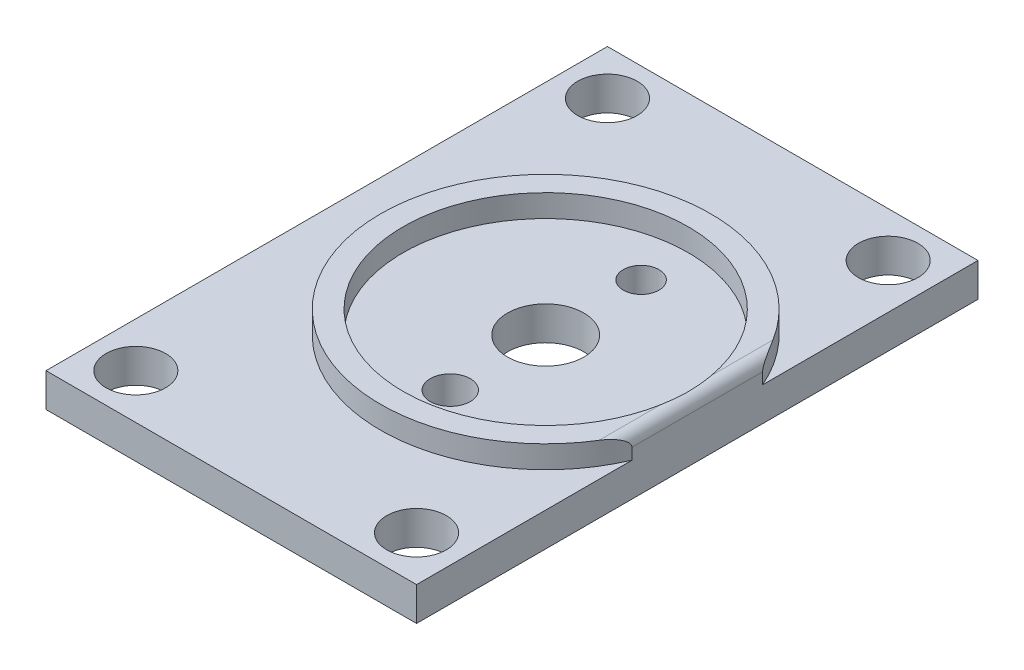
from build123d import *

# Parameters (mm, degrees)
SKETCH1_W           = 25
SKETCH1_H           = 50
SKETCH1_R           = 3.4
BOSS_EXTRUDE1_DEPTH = 3
SKETCH2_W           = 50
SKETCH2_H           = 3
BOSS_EXTRUDE2_DEPTH = 8
SKETCH3_W           = 8
SKETCH3_H           = 50
BOSS_EXTRUDE3_DEPTH = 42
SKETCH4_R           = 2.65
CUT_EXTRUDE1_DEPTH  = 3.3
SKETCH5_R           = 5.802370205
CUT_EXTRUDE2_DEPTH  = 9
FILLET2_R           = 1
SKETCH6_R           = 12.7
BOSS_EXTRUDE4_DEPTH = 2
FILLET4_R           = 1
SKETCH8_R           = 1.589780168
SKETCH8_R_2         = 1.777428262
CUT_EXTRUDE3_DEPTH  = 10
SKETCH9_W           = 8
SKETCH9_H           = 42
CUT_EXTRUDE4_DEPTH  = 68.79439129


with BuildPart() as part:
    # Sketch1 → Boss-Extrude1 (new body)
    with BuildSketch(Plane(origin=(0, 0, 0), x_dir=(1, 0, 0), z_dir=(0, 1, 0))):
        with Locations((2.276951673, 11.384758364)):
            Rectangle(SKETCH1_W, SKETCH1_H)
        with Locations(Location((1.276951673, 11.384758364, 0), (0, 0, 270))):
            Circle(SKETCH1_R, mode=Mode.SUBTRACT)
    extrude(amount=BOSS_EXTRUDE1_DEPTH)

    # Sketch2 → Boss-Extrude2 (add)
    with BuildSketch(Plane.ZY.offset(10.223048327)):
        with Locations((-11.384758364, 1.5)):
            Rectangle(SKETCH2_W, SKETCH2_H)
    extrude(amount=BOSS_EXTRUDE2_DEPTH)

    # Sketch3 → Boss-Extrude3 (add)
    with BuildSketch(Plane.XZ):
        with Locations((-14.223048327, -11.384758364)):
            Rectangle(SKETCH3_W, SKETCH3_H)
    extrude(amount=BOSS_EXTRUDE3_DEPTH)

    # Sketch4 → Cut-Extrude1 (cut)
    with BuildSketch(Plane(origin=(0, 3, 0), x_dir=(1, 0, 0), z_dir=(0, 1, 0))):
        with Locations(Location((-14.223048327, 32.384758364, 0), (0, 0, 270))):
            Circle(SKETCH4_R)
        with Locations(Location((-14.223048327, -9.615241636, 0), (0, 0, 270))):
            Circle(SKETCH4_R)
    cut_extrude1 = extrude(amount=-CUT_EXTRUDE1_DEPTH, mode=Mode.SUBTRACT)

    # Mirror1: Cut-Extrude1 across plane
    add(cut_extrude1.mirror(Plane.ZX.offset(-19.5)), mode=Mode.SUBTRACT)

    # Sketch5 → Cut-Extrude2 (cut)
    with BuildSketch(Plane.ZY.offset(18.223048327)):
        with Locations((-11.836279124, -21)):
            Circle(SKETCH5_R)
    extrude(amount=-CUT_EXTRUDE2_DEPTH, mode=Mode.SUBTRACT)

    # Fillet2
    fillet2_edges = [part.edges().sort_by_distance(p)[0] for p in [
        (-10.223048327, -21, -17.638649329),
    ]]
    fillet(fillet2_edges, radius=FILLET2_R)

    # Mirror2: Cut-Extrude1 across plane
    add(cut_extrude1.mirror(Plane.ZY.offset(1.723048327)), mode=Mode.SUBTRACT)

    # Sketch6 → Boss-Extrude4 (add)
    with BuildSketch(Plane(origin=(0, 3, 0), x_dir=(1, 0, 0), z_dir=(0, 1, 0))):
        with BuildLine():
            Line((14.776951673, 5.567542535), (14.776951673, 17.201974193))
            ThreePointArc((14.776951673, 17.201974193), (-13.423048327, 11.384758364), (14.776951673, 5.567542535))
        make_face()
        with Locations(Location((1.276951673, 11.384758364, 0), (0, 0, 270))):
            Circle(SKETCH6_R, mode=Mode.SUBTRACT)
    extrude(amount=BOSS_EXTRUDE4_DEPTH)

    # Fillet4
    # the kernel refuses this fillet: 1 mm, written as the material it takes off along each edge
    with BuildSketch(Plane(origin=(14.776951673, 5, -3.067542535), x_dir=(0, -1, 0), z_dir=(0, 0, -1))) as fillet4_piece_1:
        with BuildLine():
            CenterArc((FILLET4_R, FILLET4_R), FILLET4_R, 180, 90)
            Line((0, FILLET4_R), (0, 0))
            Line((0, 0), (FILLET4_R, 0))
        make_face()
    extrude(amount=16.634431658, mode=Mode.SUBTRACT)

    # Sketch8 → Cut-Extrude3 (cut)
    with BuildSketch(Plane(origin=(0, 3, 0), x_dir=(1, 0, 0), z_dir=(0, 1, 0))):
        with Locations(Location((1.276951673, 19.884758364, 0), (0, 0, 270))):
            Circle(SKETCH8_R)
        with Locations(Location((1.276951673, 2.884758364, 0), (0, 0, 270))):
            Circle(SKETCH8_R_2)
    extrude(amount=-CUT_EXTRUDE3_DEPTH, mode=Mode.SUBTRACT)

    # Sketch9 → Cut-Extrude4 (cut, through all)
    with BuildSketch(Plane.XY.offset(13.615241636)):
        with Locations((-14.223048327, -21)):
            Rectangle(SKETCH9_W, SKETCH9_H)
    extrude(amount=-CUT_EXTRUDE4_DEPTH, mode=Mode.SUBTRACT)


solid = part.part
